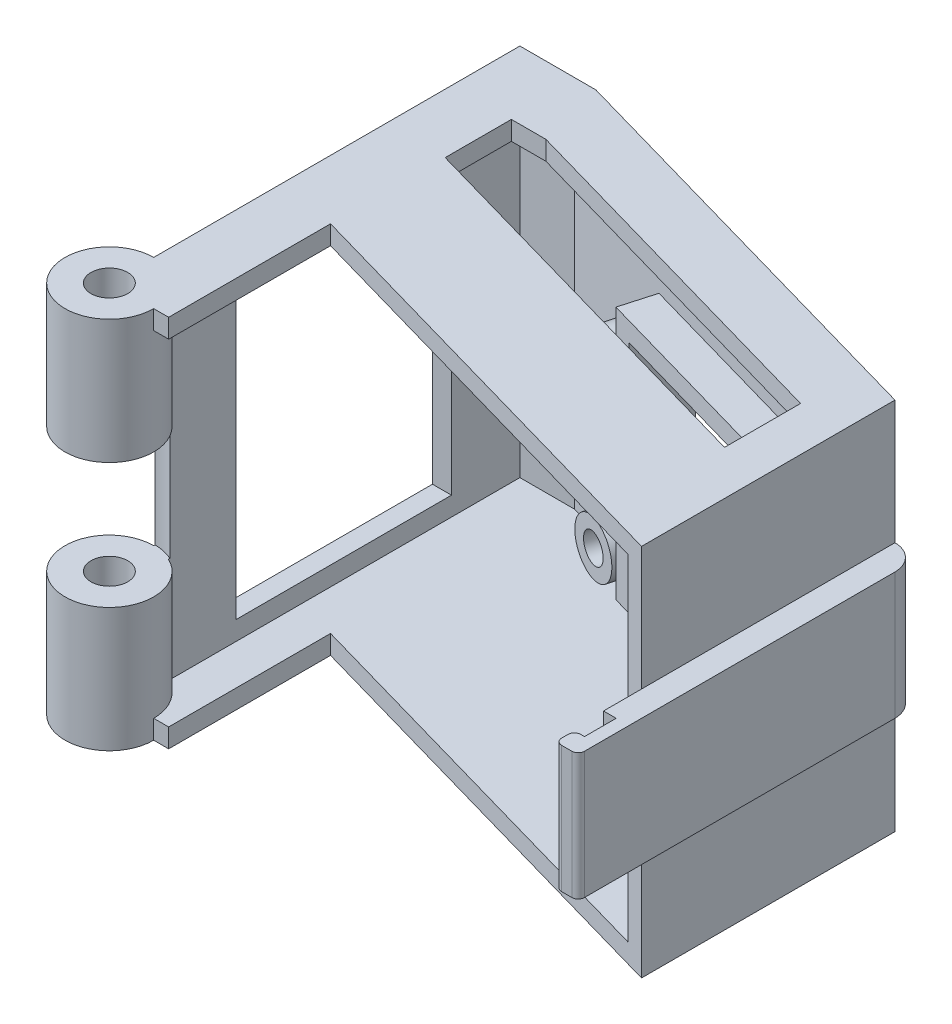
from build123d import *

# Parameters (mm, degrees)
BOSS_EXTRUDE1_DEPTH     = 29.5
SHELL1_T                = -1.5
SKETCH11_W              = 16
SKETCH11_H              = 20
BOSS_EXTRUDE6_DEPTH     = 2.75
CUT_EXTRUDE1_DEPTH      = 46.77263185
CUT_EXTRUDE1_DEPTH_BACK = 46.77263185
SKETCH3_W               = 13
SKETCH3_H               = 17
SKETCH4_R               = 2.125
BOSS_EXTRUDE2_DEPTH     = 2.8
SKETCH5_R               = 1.125
CUT_EXTRUDE2_DEPTH      = 44.905225798
SKETCH6_R               = 3.5
BOSS_EXTRUDE3_DEPTH     = 9.8
BOSS_EXTRUDE4_START     = -9.8
SKETCH7_R               = 3.5
BOSS_EXTRUDE4_DEPTH     = 9.8
SKETCH8_R               = 3.6
CUT_EXTRUDE3_DEPTH      = 9.9
SKETCH9_R               = 1.45
CUT_EXTRUDE4_DEPTH      = 44.135478309
SKETCH12_W              = 23
SKETCH12_H              = 10
BOSS_EXTRUDE7_DEPTH     = 1
SKETCH13_W              = 27
SKETCH13_H              = 10
BOSS_EXTRUDE8_DEPTH     = 1
SKETCH14_W              = 1.5
SKETCH14_H              = 10
BOSS_EXTRUDE9_DEPTH     = 0.8
FILLET2_R               = 0.5
FILLET3_R               = 0.5
FILLET4_R               = 2
CUT_EXTRUDE5_DEPTH      = 44.367750194
CUT_EXTRUDE6_REACH      = 56.452
SKETCH16_W              = 17
SKETCH16_H              = 23.5
CUT_EXTRUDE7_DEPTH      = 1.5


with BuildPart() as part:
    # Sketch2 → Boss-Extrude1 (new body)
    with BuildSketch(Plane(origin=(0, 0, 0), x_dir=(1, 0, 0), z_dir=(0, 1, 0))):
        Polygon((18.072476765, -16.342267954), (18.072476765, 6.657732046), (-14.927523235, 16.058029327), (-20.927523235, 16.058029327), (-20.927523235, -16.342267954), align=None)
    extrude(amount=BOSS_EXTRUDE1_DEPTH)

    # Shell1
    shell1_openings = [part.faces().sort_by_distance(p)[0] for p in [
        (-1.427523235, 14.75, 16.342267954),
    ]]
    offset(amount=SHELL1_T, openings=shell1_openings, kind=Kind.INTERSECTION)

    # Sketch11 → Boss-Extrude6 (add)
    with BuildSketch(Plane(origin=(2.699631824, 0, -9.477131153), x_dir=(0.9617413095492132, 0, 0.2739592186924259), z_dir=(-0.2739592186924259, 0, 0.9617413095492132))):
        with Locations((-0.825284328, 12.25)):
            Rectangle(SKETCH11_W, SKETCH11_H)
    extrude(amount=BOSS_EXTRUDE6_DEPTH)

    # Sketch3 → Cut-Extrude1 (cut, two sides: drawn at the far end of the back side and taken through both)
    with BuildSketch(Plane(origin=(2.699631824, 0, -9.477131153), x_dir=(0.9617413095492132, 0, 0.2739592186924259), z_dir=(-0.2739592186924259, 0, 0.9617413095492132)).offset(-CUT_EXTRUDE1_DEPTH_BACK)):
        with Locations((-0.825284328, 12.25)):
            Rectangle(SKETCH3_W, SKETCH3_H)
    extrude(amount=CUT_EXTRUDE1_DEPTH + CUT_EXTRUDE1_DEPTH_BACK, mode=Mode.SUBTRACT)

    # Sketch4 → Boss-Extrude2 (add)
    with BuildSketch(Plane(origin=(2.699631824, 0, -9.477131153), x_dir=(0.9617413095492132, 0, 0.2739592186924259), z_dir=(-0.2739592186924259, 0, 0.9617413095492132))):
        with Locations((9.674715672, 4.25)):
            Circle(SKETCH4_R)
        with Locations((9.674715672, 16.75)):
            Circle(SKETCH4_R)
        with Locations(Location((-11.325284328, 16.75, 0), (0, 0, 180))):
            Circle(SKETCH4_R)
        with Locations(Location((-11.325284328, 4.25, 0), (0, 0, 180))):
            Circle(SKETCH4_R)
    extrude(amount=BOSS_EXTRUDE2_DEPTH)

    # Sketch5 → Cut-Extrude2 (cut, through all)
    with BuildSketch(Plane(origin=(1.932546012, 0, -6.784255486), x_dir=(0.9617413095492132, 0, 0.2739592186924259), z_dir=(-0.2739592186924259, 0, 0.9617413095492132))):
        with Locations((9.674715672, 4.25)):
            Circle(SKETCH5_R)
        with Locations((9.674715672, 16.75)):
            Circle(SKETCH5_R)
        with Locations((-11.325284328, 4.25)):
            Circle(SKETCH5_R)
        with Locations((-11.325284328, 16.75)):
            Circle(SKETCH5_R)
    extrude(amount=-CUT_EXTRUDE2_DEPTH, mode=Mode.SUBTRACT)

    # Sketch6 → Boss-Extrude3 (add)
    with BuildSketch(Plane(origin=(0, 29.5, 0), x_dir=(1, 0, 0), z_dir=(0, 1, 0))):
        with Locations((-20.927523235, -16.342267954)):
            Circle(SKETCH6_R)
    extrude(amount=-BOSS_EXTRUDE3_DEPTH)

    # Sketch7 → Boss-Extrude4 (add)
    with BuildSketch(Plane(origin=(0, 0, 0), x_dir=(-1, 0, 0), z_dir=(0, -1, 0)).offset(BOSS_EXTRUDE4_START)):
        with Locations((20.927523235, -16.342267954)):
            Circle(SKETCH7_R)
    extrude(amount=BOSS_EXTRUDE4_DEPTH)

    # Sketch8 → Cut-Extrude3 (cut)
    with BuildSketch(Plane(origin=(0, 19.7, 0), x_dir=(-1, 0, 0), z_dir=(0, -1, 0))):
        with Locations((20.927523235, -16.342267954)):
            Circle(SKETCH8_R)
    extrude(amount=CUT_EXTRUDE3_DEPTH, mode=Mode.SUBTRACT)

    # Sketch9 → Cut-Extrude4 (cut, through all)
    with BuildSketch(Plane(origin=(0, 0, 0), x_dir=(-1, 0, 0), z_dir=(0, -1, 0))):
        with Locations(Location((20.927523235, -16.342267954, 0), (0, 0, 90))):
            Circle(SKETCH9_R)
    extrude(amount=-CUT_EXTRUDE4_DEPTH, mode=Mode.SUBTRACT)

    # Sketch12 → Boss-Extrude7 (add)
    with BuildSketch(Plane(origin=(18.072476765, 0, 0), x_dir=(0, 0, -1), z_dir=(1, 0, 0))):
        with Locations((-4.842267954, 14.75)):
            Rectangle(SKETCH12_W, SKETCH12_H)
    extrude(amount=BOSS_EXTRUDE7_DEPTH)

    # Sketch13 → Boss-Extrude8 (add)
    with BuildSketch(Plane(origin=(19.072476765, 0, 0), x_dir=(0, 0, -1), z_dir=(1, 0, 0))):
        with Locations((-6.842267954, 14.75)):
            Rectangle(SKETCH13_W, SKETCH13_H)
    extrude(amount=BOSS_EXTRUDE8_DEPTH)

    # Sketch14 → Boss-Extrude9 (add)
    with BuildSketch(Plane.ZY.offset(-19.072476765)):
        with Locations((19.592267954, 14.75)):
            Rectangle(SKETCH14_W, SKETCH14_H)
    extrude(amount=BOSS_EXTRUDE9_DEPTH)

    # Fillet2
    fillet2_edges = [part.edges().sort_by_distance(p)[0] for p in [
        (20.072476765, 14.75, 20.342267954),
        (18.272476765, 14.75, 18.842267954),
    ]]
    fillet(fillet2_edges, radius=FILLET2_R)

    # Fillet3
    fillet3_edges = [part.edges().sort_by_distance(p)[0] for p in [
        (18.272476765, 14.75, 20.342267954),
    ]]
    fillet(fillet3_edges, radius=FILLET3_R)

    # Fillet4
    fillet4_edges = [part.edges().sort_by_distance(p)[0] for p in [
        (20.072476765, 14.75, -6.657732046),
    ]]
    fillet(fillet4_edges, radius=FILLET4_R - 0.0001)  # a hair under: the kernel refuses the full size

    # Sketch15 → Cut-Extrude5 (cut, through all)
    with BuildSketch(Plane(origin=(0, 29.5, 0), x_dir=(1, 0, 0), z_dir=(0, 1, 0))):
        Polygon((18.072476765, -13.342267954), (-16.247523235, -3.565958782), (-16.247523235, -6.478203224), (-16.247523235, -16.342267954), (18.072476765, -16.342267954), align=None)
    extrude(amount=-CUT_EXTRUDE5_DEPTH, mode=Mode.SUBTRACT)

    # Sketch16 → Cut-Extrude6 (cut, up to next)
    with BuildSketch(Plane.ZY.offset(20.927523235), mode=Mode.PRIVATE) as cut_extrude6_sk1:
        with Locations((-0.657732046, 14.75)):
            Rectangle(SKETCH16_W, SKETCH16_H)
    cut_extrude6_tool1 = extrude(cut_extrude6_sk1.sketch, amount=-CUT_EXTRUDE6_REACH, mode=Mode.PRIVATE) & part.part
    add(cut_extrude6_tool1.solids().sort_by_distance((-20.927523, 14.75, -0.657732))[0], mode=Mode.SUBTRACT)

    # Sketch17 → Cut-Extrude7 (cut)
    with BuildSketch(Plane(origin=(0, 29.5, 0), x_dir=(1, 0, 0), z_dir=(0, 1, 0))):
        Polygon((-16.247523235, 5.483028504), (14.579138142, -3.298176984), (14.579138142, 2.701823016), (-13.521396163, 10.70647078), (-16.247523235, 10.70647078), align=None)
    extrude(amount=-CUT_EXTRUDE7_DEPTH, mode=Mode.SUBTRACT)


solid = part.part
